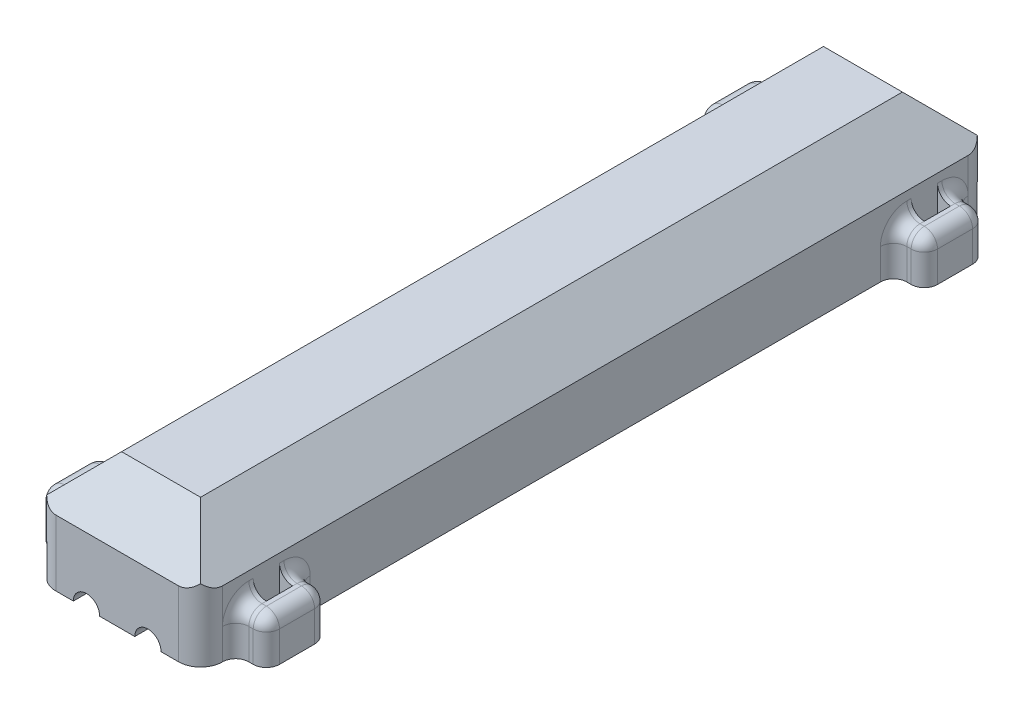
from build123d import *

# Parameters (mm, degrees)
SKETCH1_W           = 38
SKETCH1_H           = 180
BOSS_EXTRUDE1_DEPTH = 25
SKETCH2_W           = 32
SKETCH2_H           = 174
CUT_EXTRUDE1_DEPTH  = 22
CHAMFER1_SIZE       = 10
FILLET1_R           = 5
FILLET2_R           = 2
SKETCH3_W           = 14
SKETCH3_H           = 10
BOSS_EXTRUDE2_DEPTH = 7
SKETCH4_W           = 14
SKETCH4_H           = 10.939467079
BOSS_EXTRUDE3_DEPTH = 7
FILLET3_R           = 3
SKETCH5_W           = 3
SKETCH5_H           = 6
CUT_EXTRUDE2_DEPTH  = 97.958754117
SKETCH6_R           = 3
CUT_EXTRUDE3_DEPTH  = 10


with BuildPart() as part:
    # Sketch1 → Boss-Extrude1 (new body)
    with BuildSketch(Plane(origin=(0, 0, 0), x_dir=(1, 0, 0), z_dir=(0, 1, 0))):
        Rectangle(SKETCH1_W, SKETCH1_H)
    extrude(amount=BOSS_EXTRUDE1_DEPTH)

    # Sketch2 → Cut-Extrude1 (cut)
    with BuildSketch(Plane.XZ):
        Rectangle(SKETCH2_W, SKETCH2_H)
    extrude(amount=-CUT_EXTRUDE1_DEPTH, mode=Mode.SUBTRACT)

    # Chamfer1
    chamfer1_edges = [part.edges().sort_by_distance(p)[0] for p in [
        (-19, 25, 0),
        (16, 22, 0),
        (0, 25, 90),
        (0, 22, -87),
        (-16, 22, 0),
        (0, 22, 87),
        (19, 25, 0),
        (0, 25, -90),
    ]]
    chamfer(chamfer1_edges, length=CHAMFER1_SIZE)

    # Fillet1
    fillet1_edges = [part.edges().sort_by_distance(p)[0] for p in [
        (19, 7.5, 90),
        (-19, 7.5, 90),
        (-19, 7.5, -90),
        (19, 7.5, -90),
    ]]
    fillet(fillet1_edges, radius=FILLET1_R)

    # Fillet2
    fillet2_edges = [part.edges().sort_by_distance(p)[0] for p in [
        (16, 6, -87),
        (-16, 6, -87),
        (-16, 6, 87),
        (16, 6, 87),
    ]]
    fillet(fillet2_edges, radius=FILLET2_R)

    # Sketch3 → Boss-Extrude2 (add)
    with BuildSketch(Plane(origin=(19, 0, 0), x_dir=(0, 0, -1), z_dir=(1, 0, 0))):
        with Locations((-75, 5)):
            Rectangle(SKETCH3_W, SKETCH3_H)
        with Locations((75, 5)):
            Rectangle(SKETCH3_W, SKETCH3_H)
    extrude(amount=BOSS_EXTRUDE2_DEPTH)

    # Sketch4 → Boss-Extrude3 (add)
    with BuildSketch(Plane.ZY.offset(19)):
        with Locations((-75, 5.469733539)):
            Rectangle(SKETCH4_W, SKETCH4_H)
        with Locations((75, 5.469733539)):
            Rectangle(SKETCH4_W, SKETCH4_H)
    extrude(amount=BOSS_EXTRUDE3_DEPTH)

    # Fillet3
    fillet3_edges = [part.edges().sort_by_distance(p)[0] for p in [
        (19, 5, 82),
        (22.5, 10, 82),
        (19, 5, 68),
        (19, 10, 75),
        (22.5, 10, 68),
        (26, 5, 82),
        (26, 5, 68),
        (26, 10, 75),
        (19, 5, -68),
        (22.5, 10, -68),
        (19, 5, -82),
        (19, 10, -75),
        (22.5, 10, -82),
        (26, 5, -68),
        (26, 5, -82),
        (26, 10, -75),
        (-19, 5.46973354, -82),
        (-22.5, 10.939467079, -82),
        (-19, 5.46973354, -68),
        (-19, 10.939467079, -75),
        (-22.5, 10.939467079, -68),
        (-26, 5.46973354, -82),
        (-26, 5.46973354, -68),
        (-26, 10.939467079, -75),
        (-19, 5.46973354, 68),
        (-22.5, 10.939467079, 68),
        (-19, 5.46973354, 82),
        (-19, 10.939467079, 75),
        (-22.5, 10.939467079, 82),
        (-26, 5.46973354, 68),
        (-26, 5.46973354, 82),
        (-26, 10.939467079, 75),
    ]]
    fillet(fillet3_edges, radius=FILLET3_R - 0.0001)  # a hair under: the kernel refuses the full size

    # Sketch5 → Cut-Extrude2 (cut, through all)
    with BuildSketch(Plane.XZ):
        with Locations((20.5, 75)):
            Rectangle(SKETCH5_W, SKETCH5_H)
        with Locations((-20.5, -75)):
            Rectangle(SKETCH5_W, SKETCH5_H)
        with Locations((20.5, -75)):
            Rectangle(SKETCH5_W, SKETCH5_H)
        with Locations((-20.5, 75)):
            Rectangle(SKETCH5_W, SKETCH5_H)
    extrude(amount=-CUT_EXTRUDE2_DEPTH, mode=Mode.SUBTRACT)

    # Sketch6 → Cut-Extrude3 (cut)
    with BuildSketch(Plane.XY.offset(90)):
        with Locations((-7, 0)):
            Circle(SKETCH6_R)
        with Locations((7, 0)):
            Circle(SKETCH6_R)
    extrude(amount=-CUT_EXTRUDE3_DEPTH, mode=Mode.SUBTRACT)


solid = part.part
